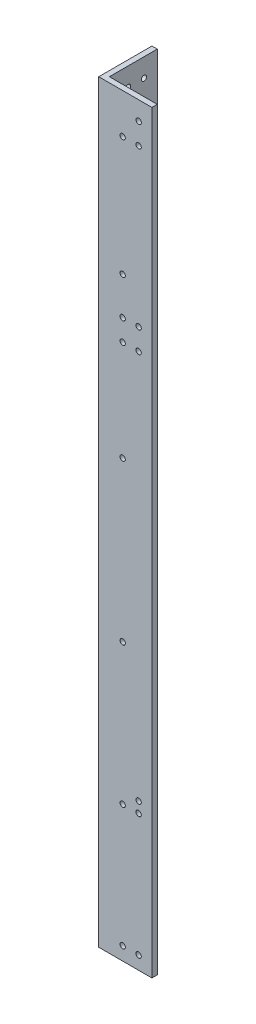
from build123d import *

# Parameters (mm, degrees)
BOSS_EXTRUDE1_DEPTH              = 450
LEFTSIDEHOLES_SKETCH3_R          = 1.5875
LEFTSIDEHOLES_CUT_EXTRUDE1_DEPTH = 3.175
BACKSIDEHOLES_SKETCH4_R          = 1.5875
BACKSIDEHOLES_CUT_EXTRUDE2_DEPTH = 3.175


with BuildPart() as part:
    # Sketch2 → Boss-Extrude1 (new body)
    with BuildSketch(Plane(origin=(0, 0, 0), x_dir=(1, 0, 0), z_dir=(0, 1, 0))):
        Polygon((0, 31.75), (3.175, 31.75), (3.175, 3.175), (31.75, 3.175), (31.75, 0), (0, 0), align=None)
    extrude(amount=BOSS_EXTRUDE1_DEPTH)

    # LeftSideHoles-Sketch3 → LeftSideHoles-Cut-Extrude1 (cut)
    with BuildSketch(Plane.XY):
        with Locations((14.2875, 81.1125)):
            Circle(LEFTSIDEHOLES_SKETCH3_R)
        with Locations((23.8125, 81.1125)):
            Circle(LEFTSIDEHOLES_SKETCH3_R)
        with Locations((23.8125, 87.4625)):
            Circle(LEFTSIDEHOLES_SKETCH3_R)
        with Locations((14.2875, 426.1875)):
            Circle(LEFTSIDEHOLES_SKETCH3_R)
        with Locations((23.8125, 438.8875)):
            Circle(LEFTSIDEHOLES_SKETCH3_R)
        with Locations((23.8125, 426.1875)):
            Circle(LEFTSIDEHOLES_SKETCH3_R)
        with Locations((14.2875, 332.602644)):
            Circle(LEFTSIDEHOLES_SKETCH3_R)
        with Locations((23.8125, 332.602644)):
            Circle(LEFTSIDEHOLES_SKETCH3_R)
        with Locations((14.2875, 319.902644)):
            Circle(LEFTSIDEHOLES_SKETCH3_R)
        with Locations((23.8125, 319.902644)):
            Circle(LEFTSIDEHOLES_SKETCH3_R)
        with Locations((14.2875, 7.9375)):
            Circle(LEFTSIDEHOLES_SKETCH3_R)
        with Locations((23.8125, 7.9375)):
            Circle(LEFTSIDEHOLES_SKETCH3_R)
        with Locations((14.2875, 165)):
            Circle(LEFTSIDEHOLES_SKETCH3_R)
        with Locations((14.2875, 260)):
            Circle(LEFTSIDEHOLES_SKETCH3_R)
        with Locations((14.2875, 355)):
            Circle(LEFTSIDEHOLES_SKETCH3_R)
    extrude(amount=-LEFTSIDEHOLES_CUT_EXTRUDE1_DEPTH, mode=Mode.SUBTRACT)

    # BackSideHoles-Sketch4 → BackSideHoles-Cut-Extrude2 (cut)
    with BuildSketch(Plane.ZY):
        with Locations((-23.8125, 81.1125)):
            Circle(BACKSIDEHOLES_SKETCH4_R)
        with Locations((-23.8125, 87.4625)):
            Circle(BACKSIDEHOLES_SKETCH4_R)
        with Locations((-14.2875, 87.4625)):
            Circle(BACKSIDEHOLES_SKETCH4_R)
        with Locations((-23.8125, 438.8875)):
            Circle(BACKSIDEHOLES_SKETCH4_R)
        with Locations((-14.2875, 438.8875)):
            Circle(BACKSIDEHOLES_SKETCH4_R)
        with Locations((-23.8125, 426.1875)):
            Circle(BACKSIDEHOLES_SKETCH4_R)
        with Locations((-23.8125, 332.602644)):
            Circle(BACKSIDEHOLES_SKETCH4_R)
        with Locations((-14.2875, 332.602644)):
            Circle(BACKSIDEHOLES_SKETCH4_R)
        with Locations((-23.8125, 326.252644)):
            Circle(BACKSIDEHOLES_SKETCH4_R)
        with Locations((-14.2875, 326.252644)):
            Circle(BACKSIDEHOLES_SKETCH4_R)
        with Locations((-14.2875, 165)):
            Circle(BACKSIDEHOLES_SKETCH4_R)
        with Locations((-14.2875, 260)):
            Circle(BACKSIDEHOLES_SKETCH4_R)
        with Locations((-14.2875, 355)):
            Circle(BACKSIDEHOLES_SKETCH4_R)
        with Locations((-23.8125, 7.9375)):
            Circle(BACKSIDEHOLES_SKETCH4_R)
        with Locations((-14.2875, 7.9375)):
            Circle(BACKSIDEHOLES_SKETCH4_R)
    extrude(amount=-BACKSIDEHOLES_CUT_EXTRUDE2_DEPTH, mode=Mode.SUBTRACT)


solid = part.part
